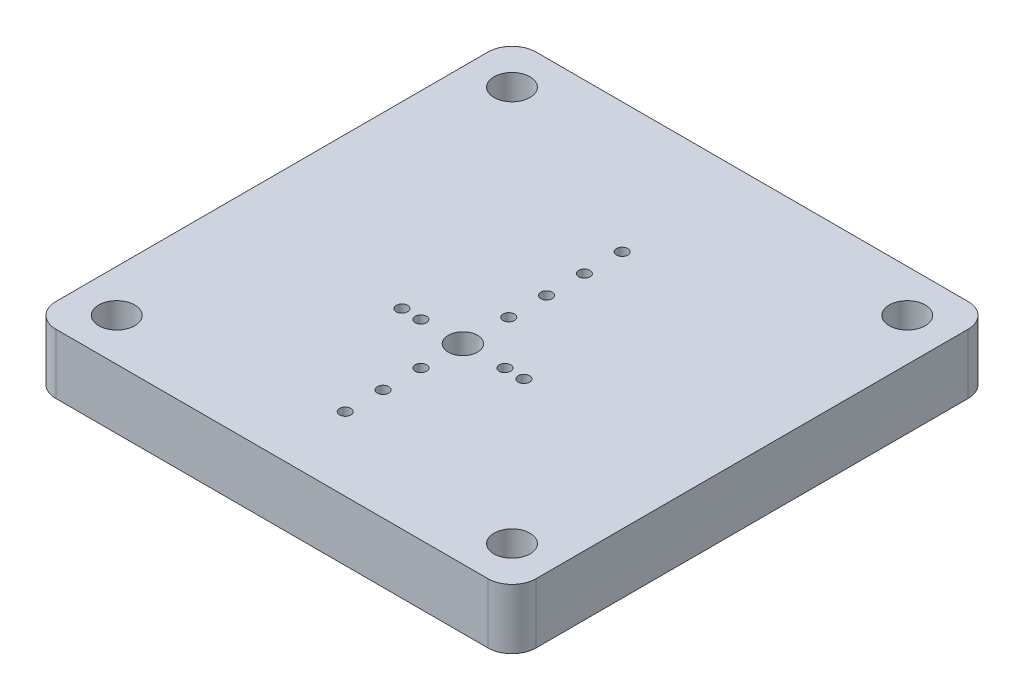
from build123d import *

# Parameters (mm, degrees)
SKETCH1_W           = 50.8
SKETCH1_H           = 50.8
SKETCH1_R           = 1.905
SKETCH1_R_2         = 0.6
SKETCH1_R_3         = 1.55
BOSS_EXTRUDE1_DEPTH = 6.35
FILLET1_R           = 2.54
SKETCH4_R           = 1.905
CUT_EXTRUDE3_DEPTH  = 3.175


with BuildPart() as part:
    # Sketch1 → Boss-Extrude1 (new body)
    with BuildSketch(Plane(origin=(0, 0, 0), x_dir=(1, 0, 0), z_dir=(0, 1, 0))):
        with Locations((25.4, 25.4)):
            Rectangle(SKETCH1_W, SKETCH1_H)
        with Locations((4.490128061, 4.490128061)):
            Circle(SKETCH1_R, mode=Mode.SUBTRACT)
        with Locations((18.954, 20.202)):
            Circle(SKETCH1_R_2, mode=Mode.SUBTRACT)
        with Locations((20.954, 20.202)):
            Circle(SKETCH1_R_2, mode=Mode.SUBTRACT)
        with Locations((25.404, 7.752)):
            Circle(SKETCH1_R_2, mode=Mode.SUBTRACT)
        with Locations((25.404, 11.752)):
            Circle(SKETCH1_R_2, mode=Mode.SUBTRACT)
        with Locations((46.309871939, 4.490128061)):
            Circle(SKETCH1_R, mode=Mode.SUBTRACT)
        with Locations((25.404, 15.752)):
            Circle(SKETCH1_R_2, mode=Mode.SUBTRACT)
        with Locations((25.404, 20.202)):
            Circle(SKETCH1_R_3, mode=Mode.SUBTRACT)
        with Locations((29.854, 20.202)):
            Circle(SKETCH1_R_2, mode=Mode.SUBTRACT)
        with Locations((25.404, 25.052)):
            Circle(SKETCH1_R_2, mode=Mode.SUBTRACT)
        with Locations((31.854, 20.202)):
            Circle(SKETCH1_R_2, mode=Mode.SUBTRACT)
        with BuildLine():
            ThreePointArc((6.395128061, 46.309871939), (3.761116122, 44.54988143), (3.143089642, 47.656910358))
            ThreePointArc((3.143089642, 47.656910358), (5.219139999, 48.069862449), (6.395128061, 46.309871939))
        make_face(mode=Mode.SUBTRACT)
        with Locations((25.404, 29.052)):
            Circle(SKETCH1_R_2, mode=Mode.SUBTRACT)
        with Locations((25.404, 33.052)):
            Circle(SKETCH1_R_2, mode=Mode.SUBTRACT)
        with Locations((25.404, 37.052)):
            Circle(SKETCH1_R_2, mode=Mode.SUBTRACT)
        with Locations((46.309871939, 46.309871939)):
            Circle(SKETCH1_R, mode=Mode.SUBTRACT)
    extrude(amount=BOSS_EXTRUDE1_DEPTH)

    # Fillet1
    fillet1_edges = [part.edges().sort_by_distance(p)[0] for p in [
        (50.8, 3.175, -50.8),
        (50.8, 3.175, 0),
        (0, 3.175, 0),
        (0, 3.175, -50.8),
    ]]
    fillet(fillet1_edges, radius=FILLET1_R)

    # Sketch4 → Cut-Extrude3 (cut)
    with BuildSketch(Plane.XZ):
        with Locations((4.490128061, -4.490128061)):
            Circle(SKETCH4_R)
        with BuildLine():
            Line((10.205128061, -4.490128061), (40.594871939, -4.490128061))
            ThreePointArc((40.594871939, -4.490128061), (42.268756685, -8.531243315), (46.309871939, -10.205128061))
            Line((46.309871939, -10.205128061), (46.309871939, -40.594871939))
            ThreePointArc((46.309871939, -40.594871939), (42.268756685, -42.268756685), (40.594871939, -46.309871939))
            Line((40.594871939, -46.309871939), (10.205128061, -46.309871939))
            ThreePointArc((10.205128061, -46.309871939), (8.531243315, -42.268756685), (4.490128061, -40.594871939))
            Line((4.490128061, -40.594871939), (4.490128061, -10.205128061))
            ThreePointArc((4.490128061, -10.205128061), (8.531243315, -8.531243315), (10.205128061, -4.490128061))
        make_face()
    extrude(amount=-CUT_EXTRUDE3_DEPTH, mode=Mode.SUBTRACT)


solid = part.part
